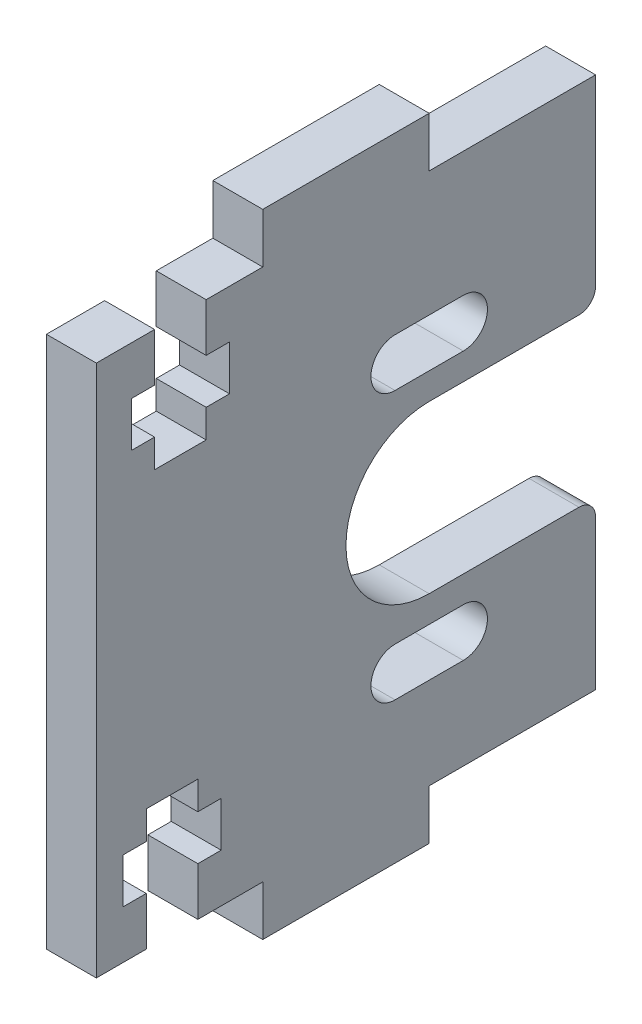
from build123d import *

# Parameters (mm, degrees)
SKETCH1_W                  = 30
SKETCH1_H                  = 38
BOSS_EXTRUDE1_DEPTH        = 3
SKETCH2_R                  = 5
CUT_EXTRUDE1_DEPTH         = 3
SKETCH6_W                  = 10
SKETCH6_H                  = 3
CUT_EXTRUDE2_DEPTH         = 3
CUT_EXTRUDE3_DEPTH         = 3
SKETCH9_W                  = 10
SKETCH9_H                  = 3
CUT_EXTRUDE5_DEPTH         = 10
CUT_EXTRUDE6_DEPTH         = 10
M2_5_CLEARANCE_SLOT1_DEPTH = 3
SKETCH17_W                 = 10
SKETCH17_H                 = 10
CUT_EXTRUDE7_DEPTH         = 10
FILLET1_R                  = 1


# Read off the part's stored shape, not the designer's step: M2.5 Clearance Slot1
with BuildPart() as part:
    # Sketch1 → Boss-Extrude1 (new body)
    with BuildSketch(Plane(origin=(0, 0, 0), x_dir=(0, 0, -1), z_dir=(1, 0, 0))):
        with Locations((15, 19)):
            Rectangle(SKETCH1_W, SKETCH1_H)
    extrude(amount=BOSS_EXTRUDE1_DEPTH)

    # Sketch2 → Cut-Extrude1 (cut)
    with BuildSketch(Plane(origin=(3, 0, 0), x_dir=(0, 0, -1), z_dir=(1, 0, 0))):
        with Locations((20, 18)):
            Circle(SKETCH2_R)
    extrude(amount=-CUT_EXTRUDE1_DEPTH, mode=Mode.SUBTRACT)

    # Sketch6 → Cut-Extrude2 (cut)
    with BuildSketch(Plane(origin=(3, 0, 0), x_dir=(0, 0, -1), z_dir=(1, 0, 0))):
        with Locations((5, 1.5)):
            Rectangle(SKETCH6_W, SKETCH6_H)
        with Locations((25, 1.5)):
            Rectangle(SKETCH6_W, SKETCH6_H)
    extrude(amount=-CUT_EXTRUDE2_DEPTH, mode=Mode.SUBTRACT)

    # Sketch7 → Cut-Extrude3 (cut)
    with BuildSketch(Plane(origin=(3, 0, 0), x_dir=(0, 0, -1), z_dir=(1, 0, 0))):
        Polygon((3, 3), (3, 5.9), (1.6, 5.9), (1.6, 8.6), (3, 8.6), (3, 10.3), (6.1, 10.3), (6.1, 8.6), (7.5, 8.6), (7.5, 5.9), (6.1, 5.9), (6.1, 3), align=None)
    extrude(amount=-CUT_EXTRUDE3_DEPTH, mode=Mode.SUBTRACT)

    # Sketch9 → Cut-Extrude5 (cut)
    with BuildSketch(Plane(origin=(3, 0, 0), x_dir=(0, 0, -1), z_dir=(1, 0, 0))):
        with Locations((5, 36.5)):
            Rectangle(SKETCH9_W, SKETCH9_H)
        with Locations((25, 36.5)):
            Rectangle(SKETCH9_W, SKETCH9_H)
    extrude(amount=-CUT_EXTRUDE5_DEPTH, mode=Mode.SUBTRACT)

    # Sketch12 → Cut-Extrude6 (cut)
    with BuildSketch(Plane(origin=(3, 0, 0), x_dir=(0, 0, -1), z_dir=(1, 0, 0))):
        Polygon((6.6, 35), (6.6, 32.1), (8, 32.1), (8, 29.4), (6.6, 29.4), (6.6, 27.7), (3.5, 27.7), (3.5, 29.4), (2.1, 29.4), (2.1, 32.1), (3.5, 32.1), (3.5, 35), align=None)
    extrude(amount=-CUT_EXTRUDE6_DEPTH, mode=Mode.SUBTRACT)

    # M2.5 Clearance Slot1 outline → M2.5 Clearance Slot1 (cut)
    with BuildSketch(Plane.YZ):
        with BuildLine():
            Line((11.4, -22.05), (11.4, -17.95))
            ThreePointArc((11.4, -17.95), (9.95, -16.5), (8.5, -17.95))
            Line((8.5, -17.95), (8.5, -22.05))
            ThreePointArc((8.5, -22.05), (9.95, -23.5), (11.4, -22.05))
        make_face()
        with BuildLine():
            Line((27.5, -22.05), (27.5, -17.95))
            ThreePointArc((27.5, -17.95), (26.05, -16.5), (24.6, -17.95))
            Line((24.6, -17.95), (24.6, -22.05))
            ThreePointArc((24.6, -22.05), (26.05, -23.5), (27.5, -22.05))
        make_face()
    extrude(amount=M2_5_CLEARANCE_SLOT1_DEPTH, mode=Mode.SUBTRACT)

    # Sketch17 → Cut-Extrude7 (cut)
    with BuildSketch(Plane(origin=(3, 0, 0), x_dir=(0, 0, -1), z_dir=(1, 0, 0))):
        with Locations((25, 18)):
            Rectangle(SKETCH17_W, SKETCH17_H)
    extrude(amount=-CUT_EXTRUDE7_DEPTH, mode=Mode.SUBTRACT)

    # Fillet1
    fillet1_edges = [part.edges().sort_by_distance(p)[0] for p in [
        (1.5, 23, -30),
        (1.5, 13, -30),
    ]]
    fillet(fillet1_edges, radius=FILLET1_R)


solid = part.part
